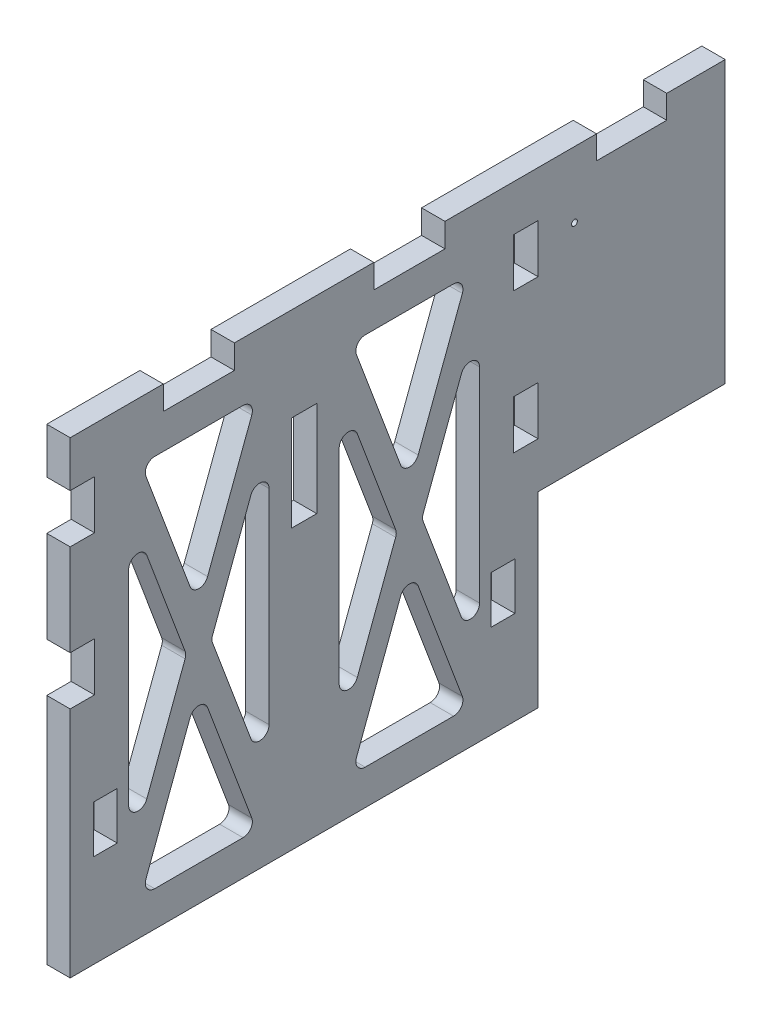
from build123d import *

# Parameters (mm, degrees)
SKETCH4_W           = 6.5024
SKETCH4_H           = 12.8524
SKETCH4_W_2         = 6.858
SKETCH4_H_2         = 25.908
BOSS_EXTRUDE1_DEPTH = 6.35
CUT_EXTRUDE1_DEPTH  = 143.132235964
FILLET1_R           = 2.54
BOSS_EXTRUDE2_DEPTH = 6.35
SKETCH8_R           = 0.79375
CUT_EXTRUDE2_DEPTH  = 171.978982627


with BuildPart() as part:
    # Sketch4 → Boss-Extrude1 (new body)
    with BuildSketch(Plane(origin=(0, 0, 0), x_dir=(0, 0, -1), z_dir=(1, 0, 0))):
        Polygon((-63.5, 0), (-3.175, 0), (3.175, 0), (63.5, 0), (63.5, 32.004), (63.5, 44.704), (63.5, 63.246), (56.896, 63.246), (56.896, 76.454), (63.5, 76.454), (63.5, 101.346), (56.896, 101.346), (56.896, 114.554), (63.5, 114.554), (63.5, 127), (38.227, 127), (38.227, 120.523), (18.923, 120.523), (18.923, 127), (-18.923, 127), (-18.923, 120.523), (-38.227, 120.523), (-38.227, 127), (-63.5, 127), (-63.5, 114.554), (-56.896, 114.554), (-56.896, 101.346), (-63.5, 101.346), (-63.5, 76.454), (-56.896, 76.454), (-56.896, 63.246), (-63.5, 63.246), (-63.5, 38.354), (-63.5, 25.654), align=None)
        with Locations((-53.975, 31.75)):
            Rectangle(SKETCH4_W, SKETCH4_H, mode=Mode.SUBTRACT)
        with Locations((53.975, 31.75)):
            Rectangle(SKETCH4_W, SKETCH4_H, mode=Mode.SUBTRACT)
        with Locations((0, 88.646)):
            Rectangle(SKETCH4_W_2, SKETCH4_H_2, mode=Mode.SUBTRACT)
    extrude(amount=BOSS_EXTRUDE1_DEPTH)

    # Sketch5 → Cut-Extrude1 (cut, through all)
    with BuildSketch(Plane(origin=(6.35, 0, 0), x_dir=(0, 0, -1), z_dir=(1, 0, 0))):
        Polygon((-12.915901486, 111.125), (-44.234098514, 111.125), (-28.575, 69.367403964), align=None)
        Polygon((-31.965901486, 60.325), (-47.625, 102.082596036), (-47.625, 18.567403964), align=None)
        Polygon((-9.525, 102.082596036), (-25.184098514, 60.325), (-9.525, 18.567403964), align=None)
        Polygon((-12.915901486, 9.525), (-28.575, 51.282596036), (-44.234098514, 9.525), align=None)
        Polygon((44.234098514, 111.125), (12.915901486, 111.125), (28.575, 69.367403964), align=None)
        Polygon((25.184098514, 60.325), (9.525, 102.082596036), (9.525, 18.567403964), align=None)
        Polygon((47.625, 102.082596036), (31.965901486, 60.325), (47.625, 18.567403964), align=None)
        Polygon((44.234098514, 9.525), (28.575, 51.282596036), (12.915901486, 9.525), align=None)
    extrude(amount=-CUT_EXTRUDE1_DEPTH, mode=Mode.SUBTRACT)

    # Fillet1
    fillet1_edges = [part.edges().sort_by_distance(p)[0] for p in [
        (3.175, 51.282596036, 28.575),
        (3.175, 9.525, 12.915901486),
        (3.175, 9.525, 44.234098514),
        (3.175, 102.082596036, 9.525),
        (3.175, 18.567403964, 9.525),
        (3.175, 60.325, 25.184098514),
        (3.175, 51.282596036, -28.575),
        (3.175, 9.525, -44.234098514),
        (3.175, 9.525, -12.915901486),
        (3.175, 60.325, -31.965901486),
        (3.175, 102.082596036, -47.625),
        (3.175, 18.567403964, -47.625),
        (3.175, 60.325, 31.965901486),
        (3.175, 18.567403964, 47.625),
        (3.175, 102.082596036, 47.625),
        (3.175, 111.125, -12.915901486),
        (3.175, 111.125, -44.234098514),
        (3.175, 69.367403964, -28.575),
        (3.175, 111.125, 12.915901486),
        (3.175, 69.367403964, 28.575),
        (3.175, 102.082596036, -9.525),
        (3.175, 60.325, -25.184098514),
        (3.175, 18.567403964, -9.525),
        (3.175, 111.125, 44.234098514),
    ]]
    fillet(fillet1_edges, radius=FILLET1_R)

    # Sketch7 → Boss-Extrude2 (add)
    with BuildSketch(Plane.ZY):
        Polygon((-63.5, 50.8), (-63.5, 127), (-79.375, 127), (-79.375, 120.65), (-98.425, 120.65), (-98.425, 127), (-114.3, 127), (-114.3, 50.8), align=None)
    extrude(amount=-BOSS_EXTRUDE2_DEPTH)

    # Sketch8 → Cut-Extrude2 (cut, through all)
    with BuildSketch(Plane(origin=(6.35, 0, 0), x_dir=(0, 0, -1), z_dir=(1, 0, 0))):
        with Locations((73.370002403, 109.091777402)):
            Circle(SKETCH8_R)
    extrude(amount=-CUT_EXTRUDE2_DEPTH, mode=Mode.SUBTRACT)


solid = part.part
